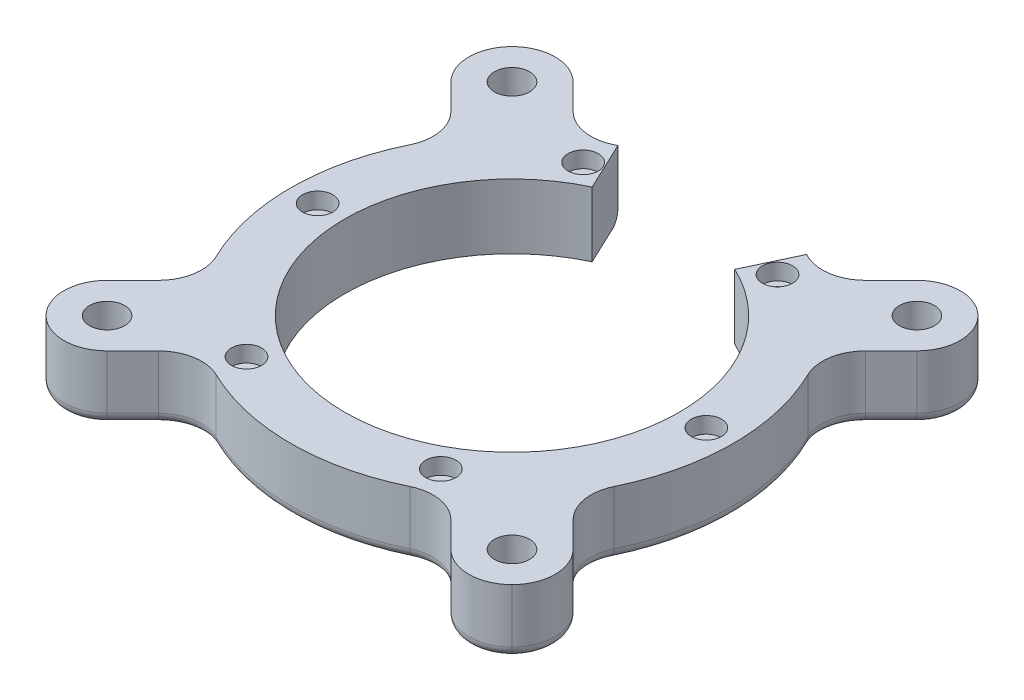
from build123d import *

# Parameters (mm, degrees)
SKETCH1_R                = 41
SKETCH1_R_2              = 31
BOSS_EXTRUDE1_DEPTH      = 12
SKETCH2_R                = 1.5
CUT_EXTRUDE1_DEPTH       = 60.211485372
CIRPATTERN1_COUNT        = 6
CUT_EXTRUDE2_DEPTH       = 60.211485372
SKETCH4_R                = 2.8
CUT_EXTRUDE3_DEPTH       = 3
CIRPATTERN2_COUNT        = 6
BOSS_EXTRUDE2_DEPTH      = 12
FILLET1_R                = 8
FILLET2_R                = 8
SKETCH6_R                = 3.25
CUT_EXTRUDE4_DEPTH       = 12
SKETCH7_R                = 5.5
CUT_EXTRUDE5_DEPTH       = 5
CIRPATTERN3_COUNT        = 4
FILLET1_OF_CIRPATTERN3_R = 8
FILLET2_OF_CIRPATTERN3_R = 8
FILLET3_R                = 2


with BuildPart() as part:
    # Sketch1 → Boss-Extrude1 (new body)
    with BuildSketch(Plane(origin=(0, 0, 0), x_dir=(1, 0, 0), z_dir=(0, 1, 0))):
        with Locations(Location((0, 0, 0), (0, 0, 270))):
            Circle(SKETCH1_R)
        with Locations(Location((0, 0, 0), (0, 0, 270))):
            Circle(SKETCH1_R_2, mode=Mode.SUBTRACT)
    extrude(amount=BOSS_EXTRUDE1_DEPTH)

    # Sketch2 → Cut-Extrude1 (cut, through all)
    with BuildSketch(Plane(origin=(0, 12, 0), x_dir=(1, 0, 0), z_dir=(0, 1, 0))):
        with Locations(Location((36, 0, 0), (0, 0, 270))):
            Circle(SKETCH2_R)
    cut_extrude1 = extrude(amount=-CUT_EXTRUDE1_DEPTH, mode=Mode.SUBTRACT)

    # CirPattern1: Cut-Extrude1 ×6 about axis
    cirpattern1_axis = Axis((0, 0, 0), (0, 1, 0))
    for i in range(1, CIRPATTERN1_COUNT):
        add(cut_extrude1.rotate(cirpattern1_axis, i * 360 / CIRPATTERN1_COUNT), mode=Mode.SUBTRACT)

    # Sketch3 → Cut-Extrude2 (cut, through all)
    with BuildSketch(Plane(origin=(0, 12, 0), x_dir=(1, 0, 0), z_dir=(0, 1, 0))):
        with BuildLine():
            Line((-17.469775307, 37.091871761), (-13.2088545, 28.045073771))
            ThreePointArc((-13.2088545, 28.045073771), (0, 31), (13.2088545, 28.045073771))
            Line((13.2088545, 28.045073771), (17.469775307, 37.091871761))
            ThreePointArc((17.469775307, 37.091871761), (0, 41), (-17.469775307, 37.091871761))
        make_face()
    extrude(amount=-CUT_EXTRUDE2_DEPTH, mode=Mode.SUBTRACT)

    # Sketch4 → Cut-Extrude3 (cut)
    with BuildSketch(Plane(origin=(0, 12, 0), x_dir=(1, 0, 0), z_dir=(0, 1, 0))):
        with Locations(Location((-18, 31.176914536, 0), (0, 0, 270))):
            Circle(SKETCH4_R)
    cut_extrude3 = extrude(amount=-CUT_EXTRUDE3_DEPTH, mode=Mode.SUBTRACT)

    # CirPattern2: Cut-Extrude3 ×6 about axis
    cirpattern2_axis = Axis((0, 0, 0), (0, 1, 0))
    for i in range(1, CIRPATTERN2_COUNT):
        add(cut_extrude3.rotate(cirpattern2_axis, i * 360 / CIRPATTERN2_COUNT), mode=Mode.SUBTRACT)

    # Sketch5 → Boss-Extrude2 (add)
    with BuildSketch(Plane.XZ):
        with BuildLine():
            Line((48.81295185, 37.499243351), (43.156097601, 43.156097601))
            Line((43.156097601, 43.156097601), (37.499243351, 48.81295185))
            Line((37.499243351, 48.81295185), (22.777280167, 34.090988666))
            ThreePointArc((22.777280167, 34.090988666), (28.991378029, 28.991378029), (34.090988666, 22.777280167))
            Line((34.090988666, 22.777280167), (48.81295185, 37.499243351))
        make_face()
    boss_extrude2 = extrude(amount=-BOSS_EXTRUDE2_DEPTH)

    # Fillet1
    fillet1_edges = [part.edges().sort_by_distance(p)[0] for p in [
        (48.81295185, 6, 37.499243351),
        (37.499243351, 6, 48.81295185),
    ]]
    fillet(fillet1_edges, radius=FILLET1_R - 0.0001)  # a hair under: the kernel refuses the full size

    # Fillet2
    fillet2_edges = [part.edges().sort_by_distance(p)[0] for p in [
        (34.090988666, 6, 22.777280167),
        (22.777280167, 6, 34.090988666),
    ]]
    fillet(fillet2_edges, radius=FILLET2_R)

    # Sketch6 → Cut-Extrude4 (cut)
    with BuildSketch(Plane.XZ):
        with Locations(Location((37.499243351, 37.499243351, 0), (0, 0, 270))):
            Circle(SKETCH6_R)
    cut_extrude4 = extrude(amount=-CUT_EXTRUDE4_DEPTH, mode=Mode.SUBTRACT)

    # Sketch7 → Cut-Extrude5 (cut)
    with BuildSketch(Plane.XZ):
        with Locations(Location((37.499243351, 37.499243351, 0), (0, 0, 270))):
            Circle(SKETCH7_R)
    cut_extrude5 = extrude(amount=-CUT_EXTRUDE5_DEPTH, mode=Mode.SUBTRACT)

    # CirPattern3: Boss-Extrude2, Cut-Extrude4, Cut-Extrude5 ×4 about axis
    cirpattern3_axis = Axis((0, 0, 0), (0, 1, 0))
    add([boss_extrude2.rotate(cirpattern3_axis, i * 360 / CIRPATTERN3_COUNT) for i in range(1, CIRPATTERN3_COUNT)])
    add([cut_extrude4.rotate(cirpattern3_axis, i * 360 / CIRPATTERN3_COUNT) for i in range(1, CIRPATTERN3_COUNT)], mode=Mode.SUBTRACT)
    add([cut_extrude5.rotate(cirpattern3_axis, i * 360 / CIRPATTERN3_COUNT) for i in range(1, CIRPATTERN3_COUNT)], mode=Mode.SUBTRACT)

    # Fillet1 of CirPattern3
    fillet1_of_cirpattern3_edges = [part.edges().sort_by_distance(p)[0] for p in [
        (37.499243351, 6, -48.81295185),
        (48.81295185, 6, -37.499243351),
        (-48.81295185, 6, -37.499243351),
        (-37.499243351, 6, -48.81295185),
        (-37.499243351, 6, 48.81295185),
        (-48.81295185, 6, 37.499243351),
    ]]
    fillet(fillet1_of_cirpattern3_edges, radius=FILLET1_OF_CIRPATTERN3_R - 0.0001)  # a hair under: the kernel refuses the full size

    # Fillet2 of CirPattern3
    fillet2_of_cirpattern3_edges = [part.edges().sort_by_distance(p)[0] for p in [
        (22.777280167, 6, -34.090988666),
        (34.090988666, 6, -22.777280167),
        (-34.090988666, 6, -22.777280167),
        (-22.777280167, 6, -34.090988666),
        (-22.777280167, 6, 34.090988666),
        (-34.090988666, 6, 22.777280167),
    ]]
    fillet(fillet2_of_cirpattern3_edges, radius=FILLET2_OF_CIRPATTERN3_R)

    # Fillet3
    fillet3_edges = [part.edges().sort_by_distance(p)[0] for p in [
        (40.781034174, 0, 29.467325675),
        (29.467325675, 0, 40.781034174),
        (37.499243351, 0, 45.499284772),
        (45.499284772, 0, 37.499243351),
        (41, 0, 0),
        (36.173142632, 0, 22.75973449),
        (22.75973449, 0, 36.173142632),
        (29.467325675, 0, -40.781034174),
        (40.781034174, 0, -29.467325675),
        (45.499284772, 0, -37.499243351),
        (37.499243351, 0, -45.499284772),
        (-40.781034174, 0, -29.467325675),
        (-29.467325675, 0, -40.781034174),
        (-37.499243351, 0, -45.499284772),
        (-45.499284772, 0, -37.499243351),
        (-29.467325675, 0, 40.781034174),
        (-40.781034174, 0, 29.467325675),
        (-45.499284772, 0, 37.499243351),
        (-37.499243351, 0, 45.499284772),
        (17.703084096, 0, -36.98108724),
        (22.75973449, 0, -36.173142632),
        (36.173142632, 0, -22.75973449),
        (-41, 0, 0),
        (-36.173142632, 0, -22.75973449),
        (-22.75973449, 0, -36.173142632),
        (0, 0, 41),
        (-22.75973449, 0, 36.173142632),
        (-36.173142632, 0, 22.75973449),
        (-17.703084096, 0, -36.98108724),
    ]]
    fillet(fillet3_edges, radius=FILLET3_R)


solid = part.part
